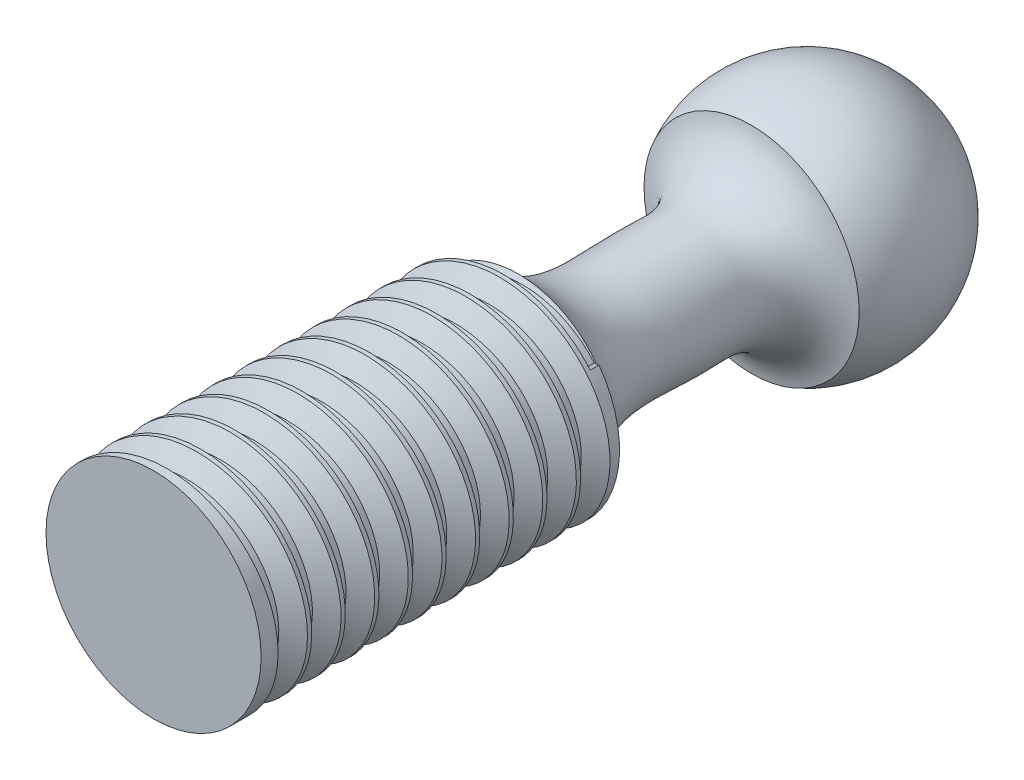
from build123d import *

# Parameters (mm, degrees)
SCHIZZO3_R                   = 4
ESTRUSIONE_ESTRUSIONE1_DEPTH = 24.3
FILETTATURA1_PITCH           = 1.25


with BuildPart() as part:
    # Schizzo2 → Rivoluzione1 (revolve)
    with BuildSketch(Plane.XY):
        with BuildLine():
            Line((13.397999688, -1.354593188), (22.397999688, -1.354593188))
            ThreePointArc((22.397999688, -1.354593188), (17.897999688, 3.145406812), (13.397999688, -1.354593188))
        make_face()
    revolve(axis=Axis((13.397999688, -1.354593188, 0), (1, 0, 0)))

    # Schizzo3 → Estrusione-Estrusione1 (add)
    with BuildSketch(Plane.XY):
        with Locations(Location((17.897999688, -1.354593188, 0), (0, 0, 180))):
            Circle(SCHIZZO3_R)
    extrude(amount=ESTRUSIONE_ESTRUSIONE1_DEPTH)

    # Filettatura1: the profile of Profilo filettatura1 profile screwed along a right-hand helix of 10.4 turns, 8 arcs to a turn; built about Z, then put on its axis
    filettatura1_z = Axis((0, 0, 0), (0, 0, 1))
    filettatura1_corners = [(4.0003, 0, -0.000173205), (4.0003, 0, 1.093923202), (3.323417656, 0, 0.703124998), (3.323417656, 0, 0.390624998)]
    with BuildLine(mode=Mode.PRIVATE) as filettatura1_profile:
        Line(filettatura1_corners[0], filettatura1_corners[1])
        Line(filettatura1_corners[1], filettatura1_corners[2])
        Line(filettatura1_corners[2], filettatura1_corners[3])
        Line(filettatura1_corners[3], filettatura1_corners[0])
    filettatura1_cap = Face(filettatura1_profile.wire())
    filettatura1_turn_angles = [0, 22.5, 45, 67.5, 90, 112.5, 135, 157.5, 180, 202.5, 225, 247.5, 270, 292.5, 315, 337.5, 360]
    filettatura1_turn_weights = [1, 0.9238795325112867, 1, 0.9238795325112867, 1, 0.9238795325112867, 1, 0.9238795325112867, 1, 0.9238795325112867, 1, 0.9238795325112867, 1, 0.9238795325112867, 1, 0.9238795325112867, 1]
    filettatura1_turn_rails = [Edge.make_bspline([Vector(p[0], p[1], 0).rotate(filettatura1_z, filettatura1_turn_angles[k]) / filettatura1_turn_weights[k] + Vector(0, 0, p[2] + FILETTATURA1_PITCH * filettatura1_turn_angles[k] / 360) for k in range(17)], [0, 0, 0, 1, 1, 2, 2, 3, 3, 4, 4, 5, 5, 6, 6, 7, 7, 8, 8, 8], 2, filettatura1_turn_weights) for p in filettatura1_corners]
    filettatura1_turn_sides = [Face.make_surface_from_curves(filettatura1_turn_rails[p[0]], filettatura1_turn_rails[p[1]]) for p in [(0, 1), (1, 2), (2, 3), (3, 0)]]
    filettatura1_last_angles = [3600, 3622.5, 3645, 3667.5, 3690, 3712.5, 3735, 3739.5, 3744]
    filettatura1_last_weights = [1, 0.9238795325112867, 1, 0.9238795325112867, 1, 0.9238795325112867, 1, 0.996917333733128, 1]
    filettatura1_last_rails = [Edge.make_bspline([Vector(p[0], p[1], 0).rotate(filettatura1_z, filettatura1_last_angles[k]) / filettatura1_last_weights[k] + Vector(0, 0, p[2] + FILETTATURA1_PITCH * filettatura1_last_angles[k] / 360) for k in range(9)], [0, 0, 0, 1, 1, 2, 2, 3, 3, 4, 4, 4], 2, filettatura1_last_weights) for p in filettatura1_corners]
    filettatura1_last_sides = [Face.make_surface_from_curves(filettatura1_last_rails[p[0]], filettatura1_last_rails[p[1]]) for p in [(0, 1), (1, 2), (2, 3), (3, 0)]]
    filettatura1 = Plane(origin=(17.897999688, -1.354593188, 24.3), x_dir=(-1, 0, 0), z_dir=(0, 0, -1)) * Solid(Shell([*[p.moved(Location((0, 0, FILETTATURA1_PITCH * i))) for i in range(10) for p in filettatura1_turn_sides], *filettatura1_last_sides, filettatura1_cap, filettatura1_cap.rotate(filettatura1_z, 3744).moved(Location((0, 0, FILETTATURA1_PITCH * 3744 / 360)))]))
    add(filettatura1, mode=Mode.SUBTRACT)

    # Schizzo5 → Taglia-Rivoluzione2 (revolve, cut)
    with BuildSketch(Plane(origin=(17.897999688, 0, 0), x_dir=(0, 0, -1), z_dir=(1, 0, 0)), mode=Mode.PRIVATE) as taglia_rivoluzione2_sk:
        with BuildLine():
            Line((-10.972144049, -5.354593188), (-2.061552813, -5.354593188))
            add(Edge.make_bspline(
                [(-10.972144049, -5.354593188), (-10.578120902, -4.440583183), (-9.324159828, -3.635427448), (-7.173761718, -3.430259027), (-5.520174629, -3.587888321), (-3.390524451, -3.388580326), (-2.223100276, -4.456512547), (-2.061552813, -5.354593188)],
                knots=[0, 0, 0, 0, 0.270254628, 0.398617723, 0.616504677, 0.750647553, 1, 1, 1, 1], degree=3))
        make_face()
    revolve(taglia_rivoluzione2_sk.sketch.rotate(Axis((17.897999688, -1.354593188, 24.299975), (0, 0, -1)), 270), axis=Axis((17.897999688, -1.354593188, 24.299975), (0, 0, -1)), mode=Mode.SUBTRACT)


solid = part.part
